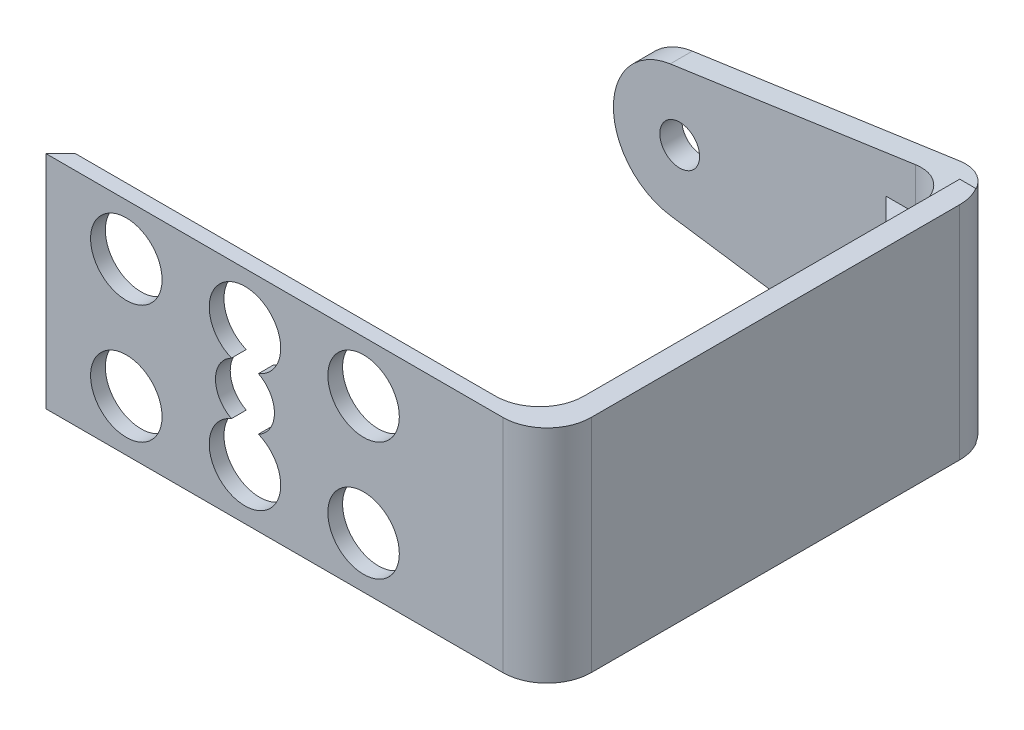
from build123d import *

# Parameters (mm, degrees)
SKETCH_1_W          = 27
SKETCH_1_H          = 15
EXTRUDE_1_DEPTH     = 1
SKETCH_2_R          = 2.425
CUT_EXTRUDE_1_DEPTH = 16.475787541
EXTRUDE_2_DEPTH     = 15
SKETCH_6_W          = 1.5
SKETCH_6_H          = 2
EXTRUDE_3_DEPTH     = 4
SKETCH_7_R          = 1.35
CUT_EXTRUDE_3_DEPTH = 1.5
FILLET_1_R          = 3
CHAMFER_1_SIZE      = 1
CUT_EXTRUDE_4_REACH = 39.101
SKETCH_8_R          = 2


# Some blends are built 0.0001 mm under size
with BuildPart() as part:
    # 草图1 → 凸台-拉伸1 (new body)
    with BuildSketch(Plane.XY):
        Rectangle(SKETCH_1_W, SKETCH_1_H)
    extrude(amount=EXTRUDE_1_DEPTH)

    # 草图2 → 切除-拉伸1 (cut, through all)
    with BuildSketch(Plane.XY.offset(1)):
        with Locations((0, 4.025)):
            Circle(SKETCH_2_R)
        with Locations((0, -4.025)):
            Circle(SKETCH_2_R)
        with Locations((8.05, 4.025)):
            Circle(SKETCH_2_R)
        with Locations((8.05, -4.025)):
            Circle(SKETCH_2_R)
        with Locations((-8.05, 4.025)):
            Circle(SKETCH_2_R)
        with Locations((-8.05, -4.025)):
            Circle(SKETCH_2_R)
    extrude(amount=-CUT_EXTRUDE_1_DEPTH, mode=Mode.SUBTRACT)

    # 草图3 → 凸台-拉伸2 (add)
    with BuildSketch(Plane.XZ.offset(7.5)):
        Polygon((13.5, 0), (19, 0), (19, -28.5), (-4.5, -28.5), (-4.5, -30), (20.5, -30), (20.5, 1), (13.5, 1), align=None)
    extrude(amount=-EXTRUDE_2_DEPTH)

    # 草图6 → 凸台-拉伸3 (add, symmetric)
    with BuildSketch(Plane(origin=(0, 0, 0), x_dir=(1, 0, 0), z_dir=(0, 1, 0))):
        Polygon((19, 0), (19, 5), (14, 0), align=None)
        Polygon((19, 28.5), (14, 28.5), (19, 23.5), align=None)
        with Locations((18.25, 20)):
            Rectangle(SKETCH_6_W, SKETCH_6_H)
    extrude(amount=EXTRUDE_3_DEPTH, both=True)

    # 草图7 → 切除-拉伸3 (cut)
    with BuildSketch(Plane(origin=(0, 0, -30), x_dir=(-1, 0, 0), z_dir=(0, 0, -1))):
        with BuildLine():
            ThreePointArc((4.5, 0), (3.401301202, -2.946379157), (0.641711051, -4.454010207))
            Line((0.641711051, -4.454010207), (-20.5, -7.5))
            Line((-20.5, -7.5), (4.5, -7.5))
            Line((4.5, -7.5), (4.5, 0))
        make_face()
        with BuildLine():
            Line((-20.5, 7.5), (0.641711051, 4.454010207))
            ThreePointArc((0.641711051, 4.454010207), (3.401301202, 2.946379157), (4.5, 0))
            Line((4.5, 0), (4.5, 7.5))
            Line((4.5, 7.5), (-20.5, 7.5))
        make_face()
        Circle(SKETCH_7_R)
    extrude(amount=-CUT_EXTRUDE_3_DEPTH, mode=Mode.SUBTRACT)

    # 圆角1
    # the kernel refuses this fillet: 3 mm, written as the material it adds along each edge
    with BuildSketch(Plane(origin=(19, -3.5, -28.5), x_dir=(-1, 0, 0), z_dir=(0, 1, 0))) as fillet_1_piece_1_section:
        with BuildLine():
            CenterArc((FILLET_1_R, FILLET_1_R), FILLET_1_R, 180, 90)
            Line((0, FILLET_1_R), (0, 0))
            Line((0, 0), (FILLET_1_R, 0))
        make_face()
    fillet_1_piece_1 = extrude(amount=18.283887658, mode=Mode.PRIVATE)
    fillet_1_piece_1 = split(fillet_1_piece_1, bisect_by=Plane(origin=(18.119115161, 7.156974268, -27.821481802), z_dir=(0.1426024558755584, -0.9897800460598605, 0)), keep=Keep.TOP, mode=Mode.PRIVATE)
    add(fillet_1_piece_1)
    with BuildSketch(Plane(origin=(19, -3.5, 0), x_dir=(0, 0, -1), z_dir=(0, 1, 0)), Plane(origin=(19, -7.5, 0), x_dir=(0, 0, -1), z_dir=(0, 1, 0))) as fillet_1_piece_2:
        with BuildLine():
            CenterArc((FILLET_1_R, FILLET_1_R), FILLET_1_R, 180, 90)
            Line((0, FILLET_1_R), (0, 0))
            Line((0, 0), (FILLET_1_R, 0))
        make_face()
    extrude(amount=11)
    with BuildSketch(Plane(origin=(19, -14.783887658, -28.5), x_dir=(-1, 0, 0), z_dir=(0, 1, 0))) as fillet_1_piece_3_section:
        with BuildLine():
            CenterArc((FILLET_1_R, FILLET_1_R), FILLET_1_R, 180, 90)
            Line((0, FILLET_1_R), (0, 0))
            Line((0, 0), (FILLET_1_R, 0))
        make_face()
    fillet_1_piece_3 = extrude(amount=18.283887658, mode=Mode.PRIVATE)
    fillet_1_piece_3 = split(fillet_1_piece_3, bisect_by=Plane(origin=(18.119115161, -7.156974268, -27.821481802), z_dir=(0.1426024558755584, 0.9897800460598605, 0)), keep=Keep.TOP, mode=Mode.PRIVATE)
    add(fillet_1_piece_3)
    # the kernel refuses this fillet: 3 mm, written as the material it takes off along each edge
    with BuildSketch(Plane(origin=(20.5, -15, 1), x_dir=(0, 0, -1), z_dir=(0, 1, 0))) as fillet_1_2_piece_1:
        with BuildLine():
            CenterArc((FILLET_1_R, FILLET_1_R), FILLET_1_R, 180, 90)
            Line((0, FILLET_1_R), (0, 0))
            Line((0, 0), (FILLET_1_R, 0))
        make_face()
    extrude(amount=30, mode=Mode.SUBTRACT)
    with BuildSketch(Plane(origin=(20.5, -15, -30), x_dir=(0, 0, 1), z_dir=(0, 1, 0))) as fillet_1_2_piece_2:
        with BuildLine():
            CenterArc((FILLET_1_R, -FILLET_1_R), FILLET_1_R, 90, 90)
            Line((0, -FILLET_1_R), (0, 0))
            Line((0, 0), (FILLET_1_R, 0))
        make_face()
    extrude(amount=30, mode=Mode.SUBTRACT)

    # 倒角1
    chamfer_1_edges = [part.edges().sort_by_distance(p)[0] for p in [
        (-13.5, 0, 0),
    ]]
    chamfer(chamfer_1_edges, length=CHAMFER_1_SIZE - 0.0001)  # a hair under: the kernel refuses the full size

    # 草图8 → 切除-拉伸4 (cut, up to next)
    with BuildSketch(Plane(origin=(0, 0, 0), x_dir=(-1, 0, 0), z_dir=(0, 0, -1)), mode=Mode.PRIVATE) as cut_extrude_4_sk1:
        Circle(SKETCH_8_R)
    cut_extrude_4_tool1 = extrude(cut_extrude_4_sk1.sketch, amount=-CUT_EXTRUDE_4_REACH, mode=Mode.PRIVATE) & part.part
    add(cut_extrude_4_tool1.solids().sort_by_distance((0, 0, 0))[0], mode=Mode.SUBTRACT)


solid = part.part
